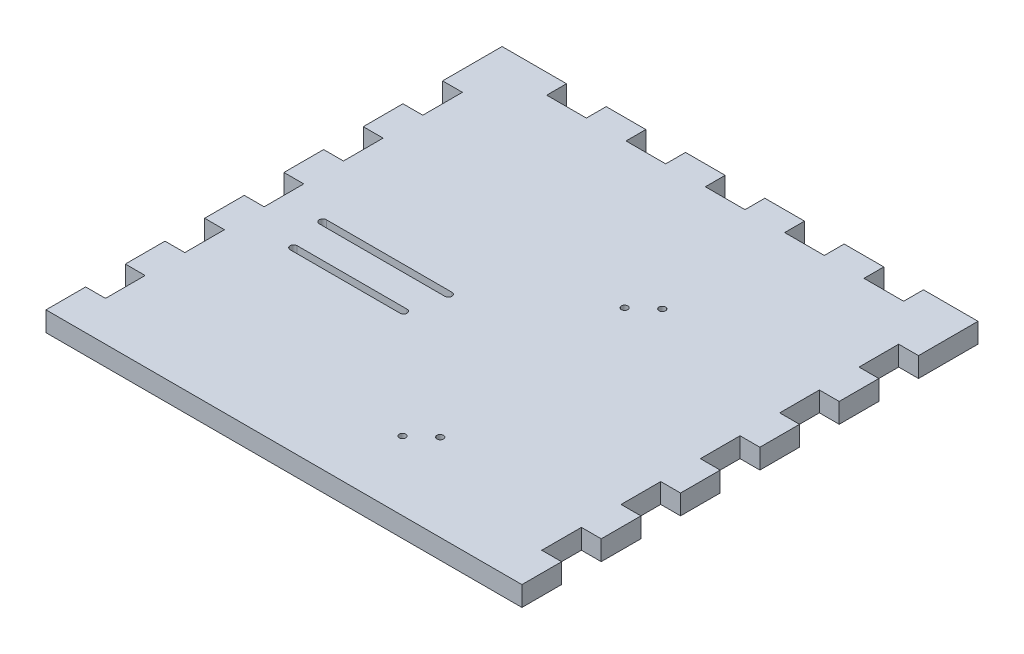
from build123d import *

# Parameters (mm, degrees)
SKETCH1_W               = 279.4
SKETCH1_H               = 279.4
BOSS_EXTRUDE1_DEPTH     = 12.7
SKETCH2_W               = 25.4
SKETCH2_H               = 12.7
BOSS_EXTRUDE2_DEPTH     = 12.7
LPATTERN1_COUNT         = 6
LPATTERN1_PITCH         = 50.8
MIRROR1_COPY_1_SKETCH_W = 25.4
MIRROR1_COPY_1_SKETCH_H = 12.7
MIRROR1_COPY_1_DEPTH    = 12.7
MIRROR1_COPY_2_SKETCH_W = 25.4
MIRROR1_COPY_2_SKETCH_H = 12.7
MIRROR1_COPY_2_DEPTH    = 12.7
MIRROR1_COPY_3_SKETCH_W = 25.4
MIRROR1_COPY_3_SKETCH_H = 12.7
MIRROR1_COPY_3_DEPTH    = 12.7
MIRROR1_COPY_4_SKETCH_W = 25.4
MIRROR1_COPY_4_SKETCH_H = 12.7
MIRROR1_COPY_4_DEPTH    = 12.7
MIRROR1_COPY_5_SKETCH_W = 25.4
MIRROR1_COPY_5_SKETCH_H = 12.7
MIRROR1_COPY_5_DEPTH    = 12.7
MIRROR1_COPY_6_SKETCH_W = 25.4
MIRROR1_COPY_6_SKETCH_H = 12.7
MIRROR1_COPY_6_DEPTH    = 12.7
SKETCH3_W               = 25.4
SKETCH3_H               = 12.7
BOSS_EXTRUDE3_DEPTH     = 12.7
LPATTERN2_COUNT         = 6
LPATTERN2_PITCH         = 50.8
SKETCH5_W               = 25.4
SKETCH5_H               = 12.7
BOSS_EXTRUDE4_DEPTH     = 12.7
SKETCH6_R               = 2.1
CUT_EXTRUDE1_DEPTH      = 216.9
SKETCH7_R               = 4.318
CUT_EXTRUDE2_DEPTH      = 6.35
SKETCH8_R               = 2.2225
CUT_EXTRUDE3_DEPTH      = 216.9
SKETCH9_R               = 6.35
CUT_EXTRUDE4_DEPTH      = 6.35
CUT_EXTRUDE5_DEPTH      = 216.9
CUT_EXTRUDE6_DEPTH      = 6.35
CUT_EXTRUDE7_DEPTH      = 6.35


with BuildPart() as part:
    # Sketch1 → Boss-Extrude1 (new body)
    with BuildSketch(Plane(origin=(0, 0, 0), x_dir=(1, 0, 0), z_dir=(0, 1, 0))):
        Rectangle(SKETCH1_W, SKETCH1_H)
    extrude(amount=BOSS_EXTRUDE1_DEPTH)

    # Sketch2 → Boss-Extrude2 (add)
    with BuildSketch(Plane(origin=(139.7, 0, 0), x_dir=(0, 0, -1), z_dir=(1, 0, 0))):
        with Locations((-127, 6.35)):
            Rectangle(SKETCH2_W, SKETCH2_H)
    boss_extrude2 = extrude(amount=BOSS_EXTRUDE2_DEPTH)

    # LPattern1: Boss-Extrude2 ×6
    with Locations(*[(0, 0, -i * LPATTERN1_PITCH) for i in range(1, LPATTERN1_COUNT)]):
        add(boss_extrude2)

    # Mirror1 copy 1 sketch → Mirror1 copy 1 (add)
    with BuildSketch(Plane(origin=(-139.7, 0, -50.8), x_dir=(0, 0, -1), z_dir=(-1, 0, 0))):
        with Locations((-127, -6.35)):
            Rectangle(MIRROR1_COPY_1_SKETCH_W, MIRROR1_COPY_1_SKETCH_H)
    extrude(amount=MIRROR1_COPY_1_DEPTH)

    # Mirror1 copy 2 sketch → Mirror1 copy 2 (add)
    with BuildSketch(Plane(origin=(-139.7, 0, -101.6), x_dir=(0, 0, -1), z_dir=(-1, 0, 0))):
        with Locations((-127, -6.35)):
            Rectangle(MIRROR1_COPY_2_SKETCH_W, MIRROR1_COPY_2_SKETCH_H)
    extrude(amount=MIRROR1_COPY_2_DEPTH)

    # Mirror1 copy 3 sketch → Mirror1 copy 3 (add)
    with BuildSketch(Plane(origin=(-139.7, 0, -152.4), x_dir=(0, 0, -1), z_dir=(-1, 0, 0))):
        with Locations((-127, -6.35)):
            Rectangle(MIRROR1_COPY_3_SKETCH_W, MIRROR1_COPY_3_SKETCH_H)
    extrude(amount=MIRROR1_COPY_3_DEPTH)

    # Mirror1 copy 4 sketch → Mirror1 copy 4 (add)
    with BuildSketch(Plane(origin=(-139.7, 0, -203.2), x_dir=(0, 0, -1), z_dir=(-1, 0, 0))):
        with Locations((-127, -6.35)):
            Rectangle(MIRROR1_COPY_4_SKETCH_W, MIRROR1_COPY_4_SKETCH_H)
    extrude(amount=MIRROR1_COPY_4_DEPTH)

    # Mirror1 copy 5 sketch → Mirror1 copy 5 (add)
    with BuildSketch(Plane(origin=(-139.7, 0, -254), x_dir=(0, 0, -1), z_dir=(-1, 0, 0))):
        with Locations((-127, -6.35)):
            Rectangle(MIRROR1_COPY_5_SKETCH_W, MIRROR1_COPY_5_SKETCH_H)
    extrude(amount=MIRROR1_COPY_5_DEPTH)

    # Mirror1 copy 6 sketch → Mirror1 copy 6 (add)
    with BuildSketch(Plane(origin=(-139.7, 0, 0), x_dir=(0, 0, -1), z_dir=(-1, 0, 0))):
        with Locations((-127, -6.35)):
            Rectangle(MIRROR1_COPY_6_SKETCH_W, MIRROR1_COPY_6_SKETCH_H)
    extrude(amount=MIRROR1_COPY_6_DEPTH)

    # Sketch3 → Boss-Extrude3 (add)
    with BuildSketch(Plane(origin=(0, 0, -139.7), x_dir=(-1, 0, 0), z_dir=(0, 0, -1))):
        with Locations((-130.175, 6.35)):
            Rectangle(SKETCH3_W, SKETCH3_H)
    boss_extrude3 = extrude(amount=BOSS_EXTRUDE3_DEPTH)

    # LPattern2: Boss-Extrude3 ×6
    with Locations(*[(-i * LPATTERN2_PITCH, 0, 0) for i in range(1, LPATTERN2_COUNT)]):
        add(boss_extrude3)

    # Sketch5 → Boss-Extrude4 (add)
    with BuildSketch(Plane(origin=(0, 0, -139.7), x_dir=(-1, 0, 0), z_dir=(0, 0, -1))):
        with Locations((-139.7, 6.35)):
            Rectangle(SKETCH5_W, SKETCH5_H)
    boss_extrude4 = extrude(amount=BOSS_EXTRUDE4_DEPTH)

    # Mirror2: Boss-Extrude4 across plane
    add(boss_extrude4.mirror(Plane(origin=(0, 0, 0), x_dir=(0, 0, 1), z_dir=(1, 0, 0))))

    # Sketch6 → Cut-Extrude1 (cut, through all)
    with BuildSketch(Plane.XZ):
        with Locations((44.45, -58.145648771)):
            Circle(SKETCH6_R)
        with Locations((31.75, -46.715648771)):
            Circle(SKETCH6_R)
        with Locations((31.75, 95.524351229)):
            Circle(SKETCH6_R)
        with Locations((44.45, 84.094351229)):
            Circle(SKETCH6_R)
    extrude(amount=-CUT_EXTRUDE1_DEPTH, mode=Mode.SUBTRACT)

    # Sketch7 → Cut-Extrude2 (cut)
    with BuildSketch(Plane.XZ):
        with Locations((31.75, 95.524351229)):
            Circle(SKETCH7_R)
        with Locations((44.45, 84.094351229)):
            Circle(SKETCH7_R)
        with Locations((31.75, -46.715648771)):
            Circle(SKETCH7_R)
        with Locations((44.45, -58.145648771)):
            Circle(SKETCH7_R)
    extrude(amount=-CUT_EXTRUDE2_DEPTH, mode=Mode.SUBTRACT)

    # Sketch8 → Cut-Extrude3 (cut, through all)
    with BuildSketch(Plane(origin=(0, 12.7, 0), x_dir=(1, 0, 0), z_dir=(0, 1, 0))):
        with Locations((-49.920301731, -25.948881859)):
            Circle(SKETCH8_R)
        with Locations((-44.920301731, -2.218881859)):
            Circle(SKETCH8_R)
        with Locations((-94.920301731, -25.948881859)):
            Circle(SKETCH8_R)
        with Locations((-99.920301731, -2.218881859)):
            Circle(SKETCH8_R)
    extrude(amount=-CUT_EXTRUDE3_DEPTH, mode=Mode.SUBTRACT)

    # Sketch9 → Cut-Extrude4 (cut)
    with BuildSketch(Plane.XZ):
        with Locations((-94.920301731, 25.948881859)):
            Circle(SKETCH9_R)
        with Locations((-99.920301731, 2.218881859)):
            Circle(SKETCH9_R)
        with Locations((-44.920301731, 2.218881859)):
            Circle(SKETCH9_R)
        with Locations((-49.920301731, 25.948881859)):
            Circle(SKETCH9_R)
    extrude(amount=-CUT_EXTRUDE4_DEPTH, mode=Mode.SUBTRACT)

    # Sketch10 → Cut-Extrude5 (cut, through all)
    with BuildSketch(Plane.XZ):
        with BuildLine():
            Line((-112.628282809, 4.483870188), (-32.184656299, 4.483870188))
            ThreePointArc((-32.184656299, 4.483870188), (-29.919667971, 2.218881859), (-32.184656299, -0.04610647))
            Line((-32.184656299, -0.04610647), (-112.628282809, -0.04610647))
            ThreePointArc((-112.628282809, -0.04610647), (-114.893271138, 2.218881859), (-112.628282809, 4.483870188))
        make_face()
        with BuildLine():
            Line((-107.547672787, 28.200110176), (-37.142684893, 28.200110176))
            ThreePointArc((-37.142684893, 28.200110176), (-34.891456576, 25.948881859), (-37.142684893, 23.697653542))
            Line((-37.142684893, 23.697653542), (-107.547672787, 23.697653542))
            ThreePointArc((-107.547672787, 23.697653542), (-109.798901104, 25.948881859), (-107.547672787, 28.200110176))
        make_face()
    extrude(amount=-CUT_EXTRUDE5_DEPTH, mode=Mode.SUBTRACT)

    # Sketch12 → Cut-Extrude6 (cut)
    with BuildSketch(Plane.XZ):
        with BuildLine():
            Line((-107.547672787, 32.464365023), (-37.791668277, 32.464365023))
            ThreePointArc((-37.791668277, 32.464365023), (-31.276185114, 25.948881859), (-37.791668277, 19.433398696))
            Line((-37.791668277, 19.433398696), (-107.547672787, 19.433398696))
            ThreePointArc((-107.547672787, 19.433398696), (-114.06315595, 25.948881859), (-107.547672787, 32.464365023))
        make_face()
    extrude(amount=-CUT_EXTRUDE6_DEPTH, mode=Mode.SUBTRACT)

    # Sketch10<3> → Cut-Extrude7 (cut)
    # profile 1 of 2: a face of its own
    with BuildSketch(Plane.XZ):
        with BuildLine():
            Line((-107.547672787, 32.316151827), (-37.142684893, 32.316151827))
            ThreePointArc((-37.142684893, 32.316151827), (-30.775414925, 25.948881859), (-37.142684893, 19.581611891))
            Line((-37.142684893, 19.581611891), (-107.547672787, 19.581611891))
            ThreePointArc((-107.547672787, 19.581611891), (-113.914942755, 25.948881859), (-107.547672787, 32.316151827))
        make_face()
        with BuildLine():
            Line((-107.547672787, 28.200110176), (-37.142684893, 28.200110176))
            ThreePointArc((-37.142684893, 28.200110176), (-34.891456576, 25.948881859), (-37.142684893, 23.697653542))
            Line((-37.142684893, 23.697653542), (-107.547672787, 23.697653542))
            ThreePointArc((-107.547672787, 23.697653542), (-109.798901104, 25.948881859), (-107.547672787, 28.200110176))
        make_face(mode=Mode.SUBTRACT)
    # profile 2 of 2: a face of its own
    with BuildSketch(Plane.XZ):
        with BuildLine():
            Line((-112.628282809, 8.69791283), (-32.184656299, 8.69791283))
            ThreePointArc((-32.184656299, 8.69791283), (-25.705625328, 2.218881859), (-32.184656299, -4.260149112))
            Line((-32.184656299, -4.260149112), (-112.628282809, -4.260149112))
            ThreePointArc((-112.628282809, -4.260149112), (-119.10731378, 2.218881859), (-112.628282809, 8.69791283))
        make_face()
        with BuildLine():
            Line((-112.628282809, 4.483870188), (-32.184656299, 4.483870188))
            ThreePointArc((-32.184656299, 4.483870188), (-29.919667971, 2.218881859), (-32.184656299, -0.04610647))
            Line((-32.184656299, -0.04610647), (-112.628282809, -0.04610647))
            ThreePointArc((-112.628282809, -0.04610647), (-114.893271138, 2.218881859), (-112.628282809, 4.483870188))
        make_face(mode=Mode.SUBTRACT)
    extrude(amount=-CUT_EXTRUDE7_DEPTH, mode=Mode.SUBTRACT)


solid = part.part
